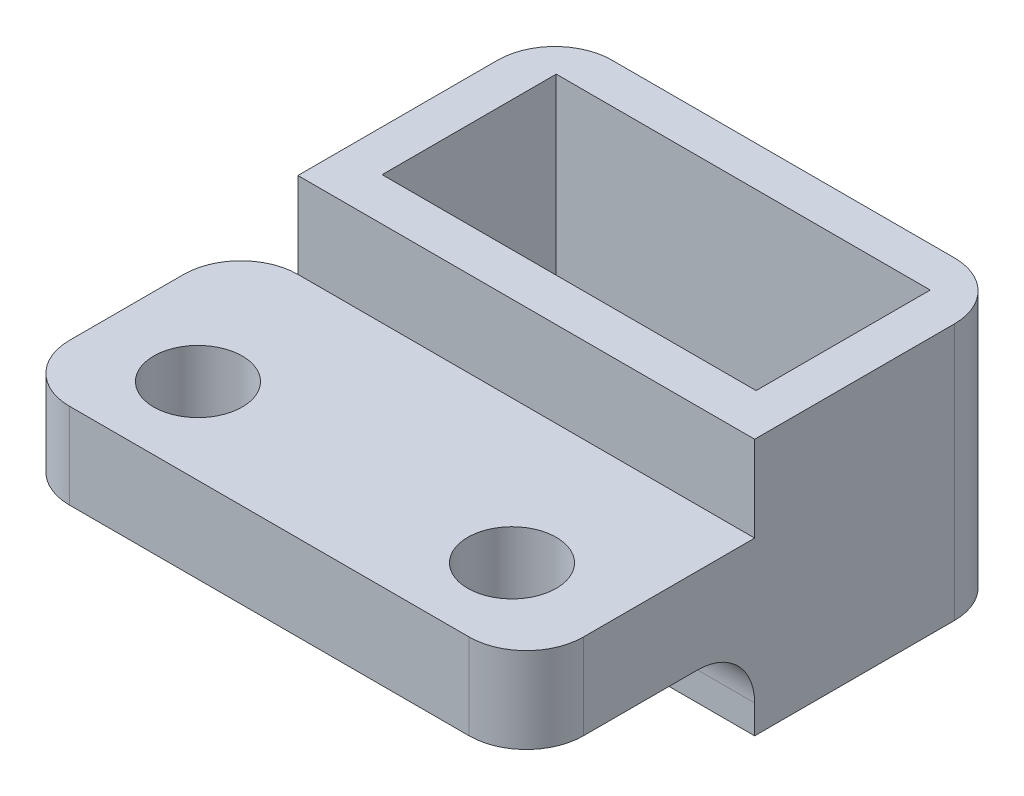
from build123d import *

# Parameters (mm, degrees)
CROQUIS1_W              = 18
CROQUIS1_H              = 18
CROQUIS1_R              = 1.55
SALIENTE_EXTRUIR1_DEPTH = 3
CROQUIS3_W              = 18
CROQUIS3_H              = 10
SALIENTE_EXTRUIR3_DEPTH = 3
CORTAR_EXTRUIR1_REACH   = 28.153
CROQUIS4_W              = 2
CROQUIS4_H              = 10
CROQUIS7_W              = 13.1
CROQUIS7_H              = 6.1
CORTAR_EXTRUIR2_DEPTH   = 6
CROQUIS9_W              = 16
CROQUIS9_H              = 10
CROQUIS9_W_2            = 13.1
CROQUIS9_H_2            = 6.1
SALIENTE_EXTRUIR4_DEPTH = 3
CROQUIS10_W             = 13.1
CROQUIS10_H             = 6.1
CROQUIS10_W_2           = 11.6
CROQUIS10_H_2           = 4.6
SALIENTE_EXTRUIR6_DEPTH = 2.5
CROQUIS11_W             = 16
CROQUIS11_H             = 1
CORTAR_EXTRUIR4_DEPTH   = 9
REDONDEO1_R             = 2


with BuildPart() as part:
    # Croquis1 → Saliente-Extruir1 (new body)
    with BuildSketch(Plane(origin=(0, 0, 0), x_dir=(1, 0, 0), z_dir=(0, 1, 0))):
        with Locations((9, 9)):
            Rectangle(CROQUIS1_W, CROQUIS1_H)
        with Locations(Location((3.5, 3, 0), (0, 0, 270))):
            Circle(CROQUIS1_R, mode=Mode.SUBTRACT)
        with Locations(Location((14.5, 3, 0), (0, 0, 270))):
            Circle(CROQUIS1_R, mode=Mode.SUBTRACT)
    extrude(amount=SALIENTE_EXTRUIR1_DEPTH)

    # Croquis3 → Saliente-Extruir3 (add)
    with BuildSketch(Plane(origin=(0, 3, 0), x_dir=(1, 0, 0), z_dir=(0, 1, 0))):
        with Locations((9, 13)):
            Rectangle(CROQUIS3_W, CROQUIS3_H)
    extrude(amount=SALIENTE_EXTRUIR3_DEPTH)

    # Cortar-Extruir1: up to this face of the body (flat: up to its plane)
    cortar_extruir1_end = Plane(part.part.faces().sort_by_distance((9, 6, -13))[0])
    # Croquis4 → Cortar-Extruir1 (cut, up to the picked face)
    with BuildSketch(Plane.XZ, mode=Mode.PRIVATE) as cortar_extruir1_sk1:
        with Locations((1, -13)):
            Rectangle(CROQUIS4_W, CROQUIS4_H)
    cortar_extruir1_tool1 = split(extrude(cortar_extruir1_sk1.sketch, amount=-CORTAR_EXTRUIR1_REACH, mode=Mode.PRIVATE), bisect_by=cortar_extruir1_end, keep=Keep.BOTH, mode=Mode.PRIVATE)
    add(cortar_extruir1_tool1.solids().sort_by(Axis((1, 0, -13), (0, 1, 0)))[0], mode=Mode.SUBTRACT)

    # Croquis7 → Cortar-Extruir2 (cut)
    with BuildSketch(Plane(origin=(0, 6, 0), x_dir=(1, 0, 0), z_dir=(0, 1, 0))):
        with Locations((10, 12.55)):
            Rectangle(CROQUIS7_W, CROQUIS7_H)
    extrude(amount=-CORTAR_EXTRUIR2_DEPTH, mode=Mode.SUBTRACT)

    # Croquis9 → Saliente-Extruir4 (add)
    with BuildSketch(Plane.XZ):
        with Locations((10, -13)):
            Rectangle(CROQUIS9_W, CROQUIS9_H)
        with Locations((10, -12.55)):
            Rectangle(CROQUIS9_W_2, CROQUIS9_H_2, mode=Mode.SUBTRACT)
    extrude(amount=SALIENTE_EXTRUIR4_DEPTH)

    # Croquis10 → Saliente-Extruir6 (add)
    with BuildSketch(Plane.XZ.offset(3)):
        with Locations((10, -12.55)):
            Rectangle(CROQUIS10_W, CROQUIS10_H)
        with Locations((10, -12.55)):
            Rectangle(CROQUIS10_W_2, CROQUIS10_H_2, mode=Mode.SUBTRACT)
    extrude(amount=-SALIENTE_EXTRUIR6_DEPTH)

    # Croquis11 → Cortar-Extruir4 (cut)
    with BuildSketch(Plane(origin=(0, 6, 0), x_dir=(1, 0, 0), z_dir=(0, 1, 0))):
        with Locations((10, 17.5)):
            Rectangle(CROQUIS11_W, CROQUIS11_H)
    extrude(amount=-CORTAR_EXTRUIR4_DEPTH, mode=Mode.SUBTRACT)

    # Redondeo1
    redondeo1_edges = [part.edges().sort_by_distance(p)[0] for p in [
        (10, 0, -8),
    ]]
    fillet(redondeo1_edges, radius=REDONDEO1_R)
    redondeo1_2_edges = [part.edges().sort_by_distance(p)[0] for p in [
        (18, 1.5, -17),
        (2, 1.5, -17),
        (0, 1.5, -8),
        (18, 1.5, 0),
        (0, 1.5, 0),
    ]]
    fillet(redondeo1_2_edges, radius=REDONDEO1_R - 0.0001)  # a hair under: the kernel refuses the full size


solid = part.part
